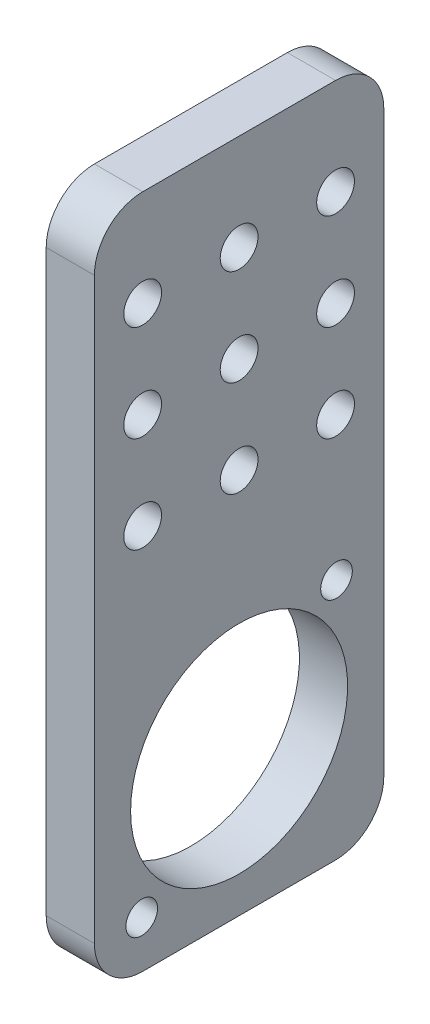
from build123d import *

# Parameters (mm, degrees)
SKETCH1_R           = 2.0828
SKETCH1_R_2         = 14.2875
SKETCH1_R_3         = 2.4892
BOSS_EXTRUDE1_DEPTH = 6.35


with BuildPart() as part:
    # Sketch1 → Boss-Extrude1 (new body)
    with BuildSketch(Plane(origin=(95.25, 0, 0), x_dir=(0, 0, -1), z_dir=(1, 0, 0))):
        with BuildLine():
            Line((-184.15, -107.95), (-184.15, -31.75))
            ThreePointArc((-184.15, -31.75), (-186.009871939, -27.259871939), (-190.5, -25.4))
            Line((-190.5, -25.4), (-215.9, -25.4))
            ThreePointArc((-215.9, -25.4), (-220.390128061, -27.259871939), (-222.25, -31.75))
            Line((-222.25, -31.75), (-222.25, -107.95))
            ThreePointArc((-222.25, -107.95), (-220.390128061, -112.440128061), (-215.9, -114.3))
            Line((-215.9, -114.3), (-190.5, -114.3))
            ThreePointArc((-190.5, -114.3), (-186.009871939, -112.440128061), (-184.15, -107.95))
        make_face()
        with Locations((-190.376194259, -82.426194259)):
            Circle(SKETCH1_R, mode=Mode.SUBTRACT)
        with Locations((-216.023805741, -108.073805741)):
            Circle(SKETCH1_R, mode=Mode.SUBTRACT)
        with Locations((-203.2, -95.25)):
            Circle(SKETCH1_R_2, mode=Mode.SUBTRACT)
        with Locations((-215.9, -38.1)):
            Circle(SKETCH1_R_3, mode=Mode.SUBTRACT)
        with Locations((-203.2, -38.1)):
            Circle(SKETCH1_R_3, mode=Mode.SUBTRACT)
        with Locations((-190.5, -38.1)):
            Circle(SKETCH1_R_3, mode=Mode.SUBTRACT)
        with Locations((-215.9, -63.5)):
            Circle(SKETCH1_R_3, mode=Mode.SUBTRACT)
        with Locations((-203.2, -63.5)):
            Circle(SKETCH1_R_3, mode=Mode.SUBTRACT)
        with Locations((-190.5, -63.5)):
            Circle(SKETCH1_R_3, mode=Mode.SUBTRACT)
        with Locations((-215.9, -50.8)):
            Circle(SKETCH1_R_3, mode=Mode.SUBTRACT)
        with Locations((-203.2, -50.8)):
            Circle(SKETCH1_R_3, mode=Mode.SUBTRACT)
        with Locations((-190.5, -50.8)):
            Circle(SKETCH1_R_3, mode=Mode.SUBTRACT)
    extrude(amount=-BOSS_EXTRUDE1_DEPTH)


solid = part.part
